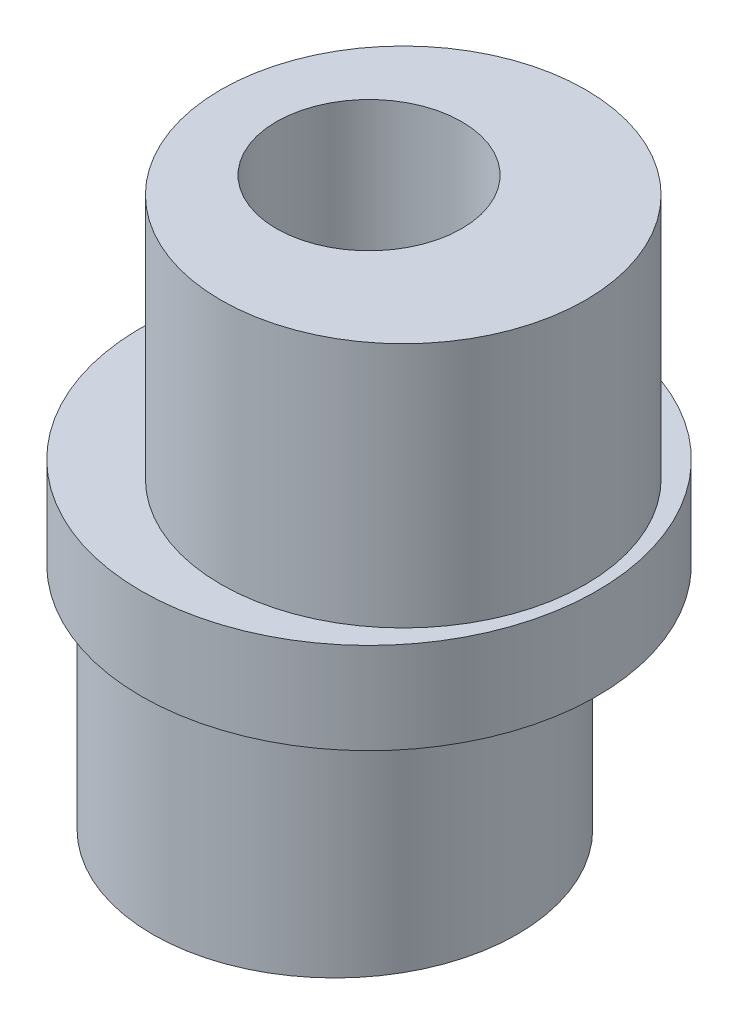
from build123d import *

# Parameters (mm, degrees)
SKETCH1_R           = 7.5
BOSS_EXTRUDE1_DEPTH = 3
SKETCH2_R           = 6
BOSS_EXTRUDE2_DEPTH = 8.1
SKETCH3_R           = 6
BOSS_EXTRUDE3_DEPTH = 8.1
SKETCH4_R           = 3.05
CUT_EXTRUDE1_DEPTH  = 24.1


with BuildPart() as part:
    # Sketch1 → Boss-Extrude1 (new body)
    with BuildSketch(Plane(origin=(0, 0, 0), x_dir=(1, 0, 0), z_dir=(0, 1, 0))):
        Circle(SKETCH1_R)
    extrude(amount=BOSS_EXTRUDE1_DEPTH)

    # Sketch2 → Boss-Extrude2 (add)
    with BuildSketch(Plane(origin=(0, 3, 0), x_dir=(1, 0, 0), z_dir=(0, 1, 0))):
        with Locations((1.125, 0)):
            Circle(SKETCH2_R)
    extrude(amount=BOSS_EXTRUDE2_DEPTH)

    # Sketch3 → Boss-Extrude3 (add)
    with BuildSketch(Plane.XZ):
        with Locations((-1.125, 0)):
            Circle(SKETCH3_R)
    extrude(amount=BOSS_EXTRUDE3_DEPTH)

    # Sketch4 → Cut-Extrude1 (cut)
    with BuildSketch(Plane(origin=(0, 11.1, 0), x_dir=(1, 0, 0), z_dir=(0, 1, 0))):
        Circle(SKETCH4_R)
    extrude(amount=-CUT_EXTRUDE1_DEPTH, mode=Mode.SUBTRACT)


solid = part.part
